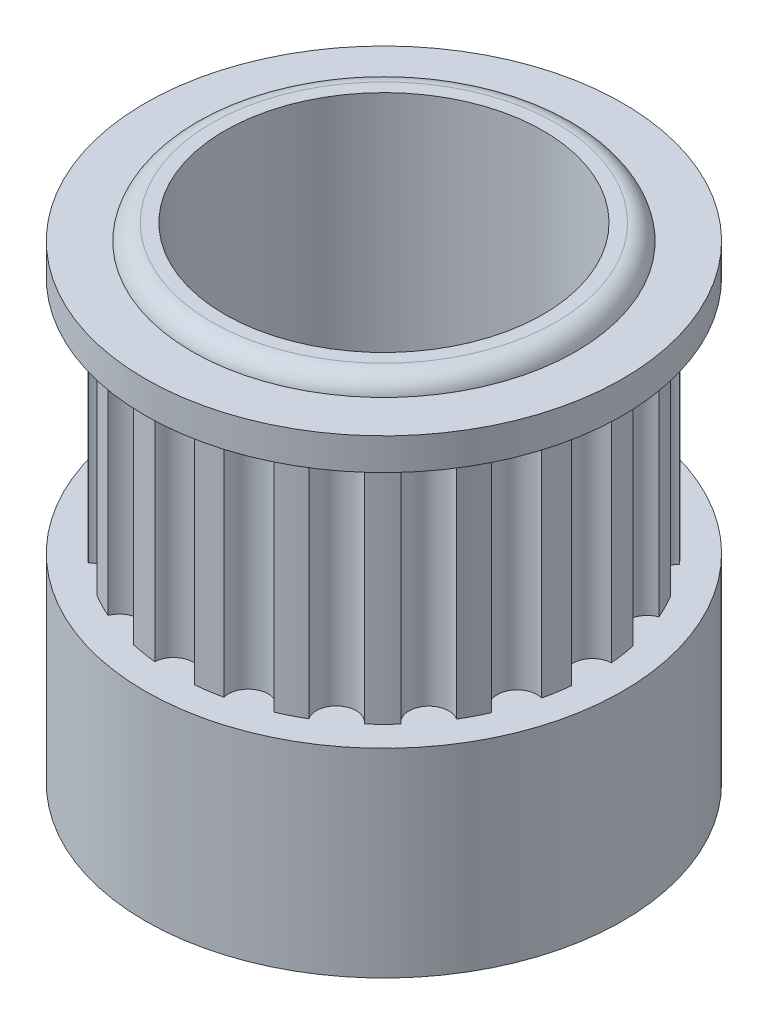
from build123d import *

# Parameters (mm, degrees)
SKETCH1_R           = 6
BOSS_EXTRUDE1_DEPTH = 5
SKETCH2_R           = 5.262480872
BOSS_EXTRUDE2_DEPTH = 6
SKETCH3_R           = 0.5
CUT_EXTRUDE1_DEPTH  = 6
SKETCH4_R           = 6
BOSS_EXTRUDE3_DEPTH = 0.8
SKETCH5_R           = 4.819461856
BOSS_EXTRUDE4_DEPTH = 0.4
FILLET3_R           = 0.5
SKETCH6_R           = 4
CUT_EXTRUDE2_DEPTH  = 15.860686391


with BuildPart() as part:
    # Sketch1 → Boss-Extrude1 (new body)
    with BuildSketch(Plane(origin=(0, 0, 0), x_dir=(1, 0, 0), z_dir=(0, 1, 0))):
        with Locations(Location((0, 0, 0), (0, 0, 270))):
            Circle(SKETCH1_R)
    extrude(amount=BOSS_EXTRUDE1_DEPTH)

    # Sketch2 → Boss-Extrude2 (add)
    with BuildSketch(Plane(origin=(0, 5, 0), x_dir=(1, 0, 0), z_dir=(0, 1, 0))):
        with Locations(Location((0, 0, 0), (0, 0, 270))):
            Circle(SKETCH2_R)
    extrude(amount=BOSS_EXTRUDE2_DEPTH)

    # Sketch3 → Cut-Extrude1 (cut)
    with BuildSketch(Plane(origin=(0, 11, 0), x_dir=(1, 0, 0), z_dir=(0, 1, 0))):
        with Locations((-1.603876434, 5.012113856)):
            Circle(SKETCH3_R)
        with Locations((0.023451225, 5.262428619)):
            Circle(SKETCH3_R)
        with Locations((1.648483316, 4.997620202)):
            Circle(SKETCH3_R)
        with Locations((3.112150373, 4.2436099)):
            Circle(SKETCH3_R)
        with Locations((4.271178469, 3.074205493)):
            Circle(SKETCH3_R)
        with Locations((5.012113856, 1.603876434)):
            Circle(SKETCH3_R)
        with Locations((5.262428619, -0.023451225)):
            Circle(SKETCH3_R)
        with Locations((4.997620202, -1.648483316)):
            Circle(SKETCH3_R)
        with Locations((4.2436099, -3.112150373)):
            Circle(SKETCH3_R)
        with Locations((3.074205493, -4.271178469)):
            Circle(SKETCH3_R)
        with Locations((1.603876434, -5.012113856)):
            Circle(SKETCH3_R)
        with Locations((-0.023451225, -5.262428619)):
            Circle(SKETCH3_R)
        with Locations((-1.648483316, -4.997620202)):
            Circle(SKETCH3_R)
        with Locations((-3.112150373, -4.2436099)):
            Circle(SKETCH3_R)
        with Locations((-4.271178469, -3.074205493)):
            Circle(SKETCH3_R)
        with Locations((-5.012113856, -1.603876434)):
            Circle(SKETCH3_R)
        with Locations((-5.262428619, 0.023451225)):
            Circle(SKETCH3_R)
        with Locations((-4.997620202, 1.648483316)):
            Circle(SKETCH3_R)
        with Locations((-4.2436099, 3.112150373)):
            Circle(SKETCH3_R)
        with Locations((-3.074205493, 4.271178469)):
            Circle(SKETCH3_R)
    extrude(amount=-CUT_EXTRUDE1_DEPTH, mode=Mode.SUBTRACT)

    # Sketch4 → Boss-Extrude3 (add)
    with BuildSketch(Plane(origin=(0, 11, 0), x_dir=(1, 0, 0), z_dir=(0, 1, 0))):
        with Locations(Location((0, 0, 0), (0, 0, 270))):
            Circle(SKETCH4_R)
    extrude(amount=BOSS_EXTRUDE3_DEPTH)

    # Sketch5 → Boss-Extrude4 (add)
    with BuildSketch(Plane(origin=(0, 11.8, 0), x_dir=(1, 0, 0), z_dir=(0, 1, 0))):
        with Locations(Location((0, 0, 0), (0, 0, 270))):
            Circle(SKETCH5_R)
    extrude(amount=BOSS_EXTRUDE4_DEPTH)

    # Fillet3
    # the kernel refuses this fillet: 0.5 mm, written as the material it takes off along each edge
    with BuildSketch(Plane(origin=(0, 12.2, 0), x_dir=(0, 0, 1), z_dir=(-1, 0, 0))) as fillet3_piece_1:
        with BuildLine():
            CenterArc((4.329563907, -0.5), FILLET3_R, 11.536959033, 78.463040967)
            Line((4.329563907, 0), (4.329563907, 0.01))
            Line((4.329563907, 0.01), (4.819461856, 0.01))
            Line((4.819461856, 0.01), (4.829461856, 0))
            ThreePointArc((4.829461856, 0), (4.829461856, -0.2), (4.829259815, -0.398))
            Line((4.829259815, -0.398), (4.819461856, -0.4))
        make_face()
    revolve(axis=Axis((0, 12.2, 0), (0, 1, 0)), mode=Mode.SUBTRACT)

    # Sketch6 → Cut-Extrude2 (cut, through all)
    with BuildSketch(Plane(origin=(0, 12.2, 0), x_dir=(1, 0, 0), z_dir=(0, 1, 0))):
        with Locations(Location((0, 0, 0), (0, 0, 270))):
            Circle(SKETCH6_R)
    extrude(amount=-CUT_EXTRUDE2_DEPTH, mode=Mode.SUBTRACT)


solid = part.part
